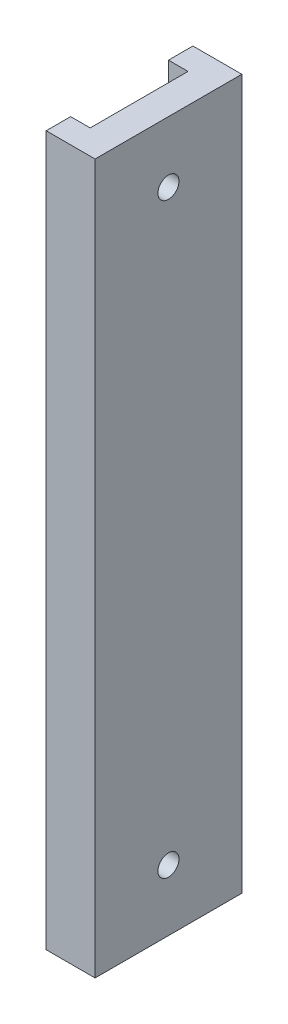
from build123d import *

# Parameters (mm, degrees)
BOSS_EXTRUDE1_DEPTH  = 145
M4_CLEARANCE_HOLE1_D = 4.3


with BuildPart() as part:
    # Sketch1 → Boss-Extrude1 (new body)
    with BuildSketch(Plane(origin=(0, 260, 0), x_dir=(-1, 0, 0), z_dir=(0, -1, 0))):
        Polygon((71.5, -127.5), (61.5, -127.5), (61.5, -97.5), (71.5, -97.5), (71.5, -102.5), (67.5, -102.5), (67.5, -122.5), (71.5, -122.5), align=None)
    extrude(amount=BOSS_EXTRUDE1_DEPTH)

    # M4 Clearance Hole1 (through all)
    with Locations(Plane(origin=(-61.5, 0, 0), x_dir=(0, 0, -1), z_dir=(1, 0, 0))):
        with Locations((-112.5, 247.5), (-112.5, 127.5)):
            Hole(M4_CLEARANCE_HOLE1_D / 2)


solid = part.part
